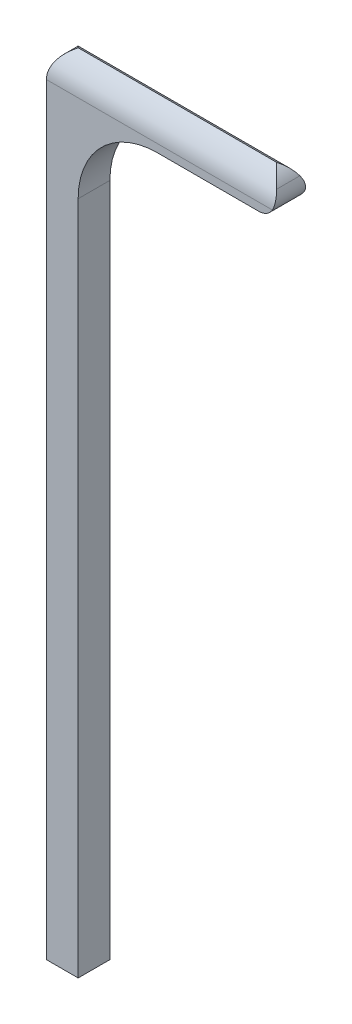
from build123d import *

# Parameters (mm, degrees)
SKETCH1_W           = 4
SKETCH1_H           = 4
BOSS_EXTRUDE1_DEPTH = 100
SKETCH2_W           = 4
SKETCH2_H           = 5
BOSS_EXTRUDE2_DEPTH = 25
FILLET1_R           = 10
FILLET3_R           = 4
FILLET4_R           = 2


with BuildPart() as part:
    # Sketch1 → Boss-Extrude1 (new body)
    with BuildSketch(Plane(origin=(0, 0, 0), x_dir=(1, 0, 0), z_dir=(0, 1, 0))):
        with Locations((2, 2)):
            Rectangle(SKETCH1_W, SKETCH1_H)
    extrude(amount=BOSS_EXTRUDE1_DEPTH)

    # Sketch2 → Boss-Extrude2 (add)
    with BuildSketch(Plane(origin=(4, 0, 0), x_dir=(0, 0, -1), z_dir=(1, 0, 0))):
        with Locations((2, 97.5)):
            Rectangle(SKETCH2_W, SKETCH2_H)
    extrude(amount=BOSS_EXTRUDE2_DEPTH)

    # Fillet1
    fillet1_edges = [part.edges().sort_by_distance(p)[0] for p in [
        (4, 95, -2),
    ]]
    fillet(fillet1_edges, radius=FILLET1_R)

    # Fillet3
    # the kernel refuses this fillet: 4 mm, written as the material it takes off along each edge
    with BuildSketch(Plane(origin=(39, 100, -4), x_dir=(0, 0, 1), z_dir=(-1, 0, 0)), Plane(origin=(39, 100, 0), x_dir=(0, -1, 0), z_dir=(-1, 0, 0))) as fillet3_piece_1:
        with BuildLine():
            CenterArc((FILLET3_R, -FILLET3_R), FILLET3_R, 90, 90)
            Line((0, -FILLET3_R), (0, 0))
            Line((0, 0), (FILLET3_R, 0))
        make_face()
    extrude(amount=49, mode=Mode.SUBTRACT)
    with BuildSketch(Plane(origin=(29, 100, -14), x_dir=(0, -1, 0), z_dir=(0, 0, 1)), Plane(origin=(0, 100, -14), x_dir=(1, 0, 0), z_dir=(0, 0, 1))) as fillet3_piece_2:
        with BuildLine():
            CenterArc((FILLET3_R, -FILLET3_R), FILLET3_R, 90, 90)
            Line((0, -FILLET3_R), (0, 0))
            Line((0, 0), (FILLET3_R, 0))
        make_face()
    extrude(amount=24, mode=Mode.SUBTRACT)

    # Fillet4
    # the kernel refuses this fillet: 2 mm, written as the material it takes off along each edge
    with BuildSketch(Plane(origin=(29, 95, 7.618721628), x_dir=(-1, 0, 0), z_dir=(0, 0, -1))) as fillet4_piece_1:
        with BuildLine():
            CenterArc((2.267949192, 2), FILLET4_R, 150, 120)
            Line((0.535898385, 3), (0.362693304, 3.1))
            ThreePointArc((0.362693304, 3.1), (-0.2, 1), (-0.2, 0))
            Line((-0.2, 0), (0, -0.2))
            Line((0, -0.2), (2.267949192, -0.2))
            Line((2.267949192, -0.2), (2.267949192, 0))
        make_face()
    extrude(amount=19.237443256, mode=Mode.SUBTRACT)


solid = part.part
